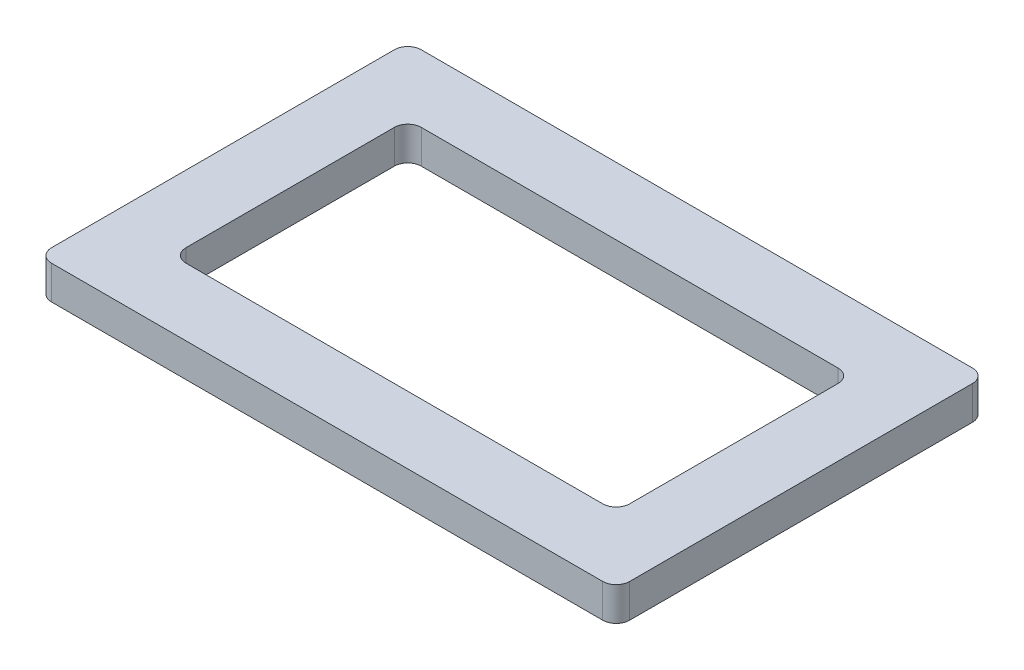
from build123d import *

# Parameters (mm, degrees)
SKETCH1_W           = 86
SKETCH1_H           = 55
BOSS_EXTRUDE1_DEPTH = 5
SKETCH2_R           = 7.5
CUT_EXTRUDE1_DEPTH  = 52.285962992
SKETCH3_W           = 66
SKETCH3_H           = 35
CUT_EXTRUDE2_DEPTH  = 52.285962992
FILLET1_R           = 2


with BuildPart() as part:
    # Sketch1 → Boss-Extrude1 (new body)
    with BuildSketch(Plane(origin=(0, 0, 0), x_dir=(1, 0, 0), z_dir=(0, 1, 0))):
        Rectangle(SKETCH1_W, SKETCH1_H)
    extrude(amount=BOSS_EXTRUDE1_DEPTH)

    # Sketch2 → Cut-Extrude1 (cut, through all)
    with BuildSketch(Plane(origin=(0, 5, 0), x_dir=(1, 0, 0), z_dir=(0, 1, 0))):
        with Locations((19, -2.5)):
            Circle(SKETCH2_R)
    extrude(amount=-CUT_EXTRUDE1_DEPTH, mode=Mode.SUBTRACT)

    # Sketch3 → Cut-Extrude2 (cut, through all)
    with BuildSketch(Plane(origin=(0, 5, 0), x_dir=(1, 0, 0), z_dir=(0, 1, 0))):
        Rectangle(SKETCH3_W, SKETCH3_H)
    extrude(amount=-CUT_EXTRUDE2_DEPTH, mode=Mode.SUBTRACT)

    # Fillet1
    fillet1_edges = [part.edges().sort_by_distance(p)[0] for p in [
        (33, 2.5, 17.5),
        (33, 2.5, -17.5),
        (-33, 2.5, 17.5),
        (-33, 2.5, -17.5),
        (43, 2.5, -27.5),
        (43, 2.5, 27.5),
        (-43, 2.5, -27.5),
        (-43, 2.5, 27.5),
    ]]
    fillet(fillet1_edges, radius=FILLET1_R)


solid = part.part
